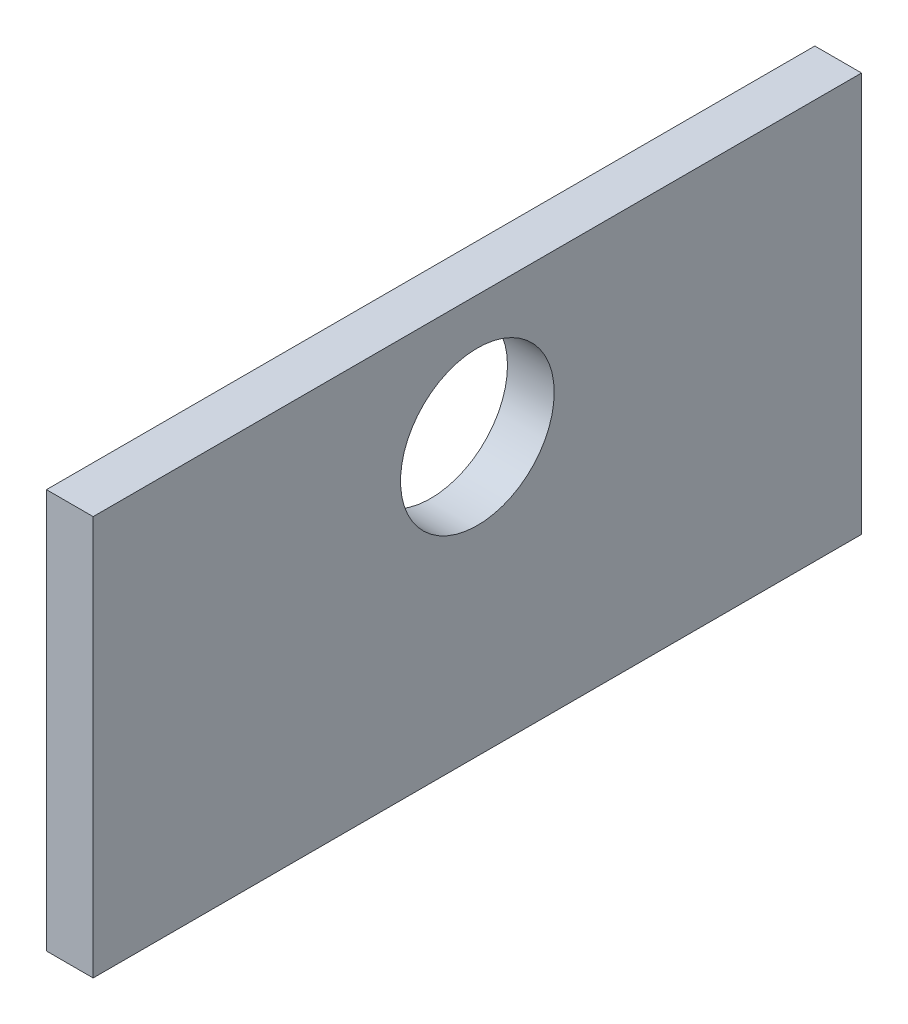
from build123d import *

# Parameters (mm, degrees)
SKETCH1_W           = 79.375
SKETCH1_H           = 41.275
SKETCH1_R           = 7.9375
BOSS_EXTRUDE1_DEPTH = 4.826


with BuildPart() as part:
    # Sketch1 → Boss-Extrude1 (new body)
    with BuildSketch(Plane(origin=(0, 0, 0), x_dir=(0, 0, -1), z_dir=(1, 0, 0))):
        with Locations((0, -7.9375)):
            Rectangle(SKETCH1_W, SKETCH1_H)
        Circle(SKETCH1_R, mode=Mode.SUBTRACT)
    extrude(amount=BOSS_EXTRUDE1_DEPTH)


solid = part.part
